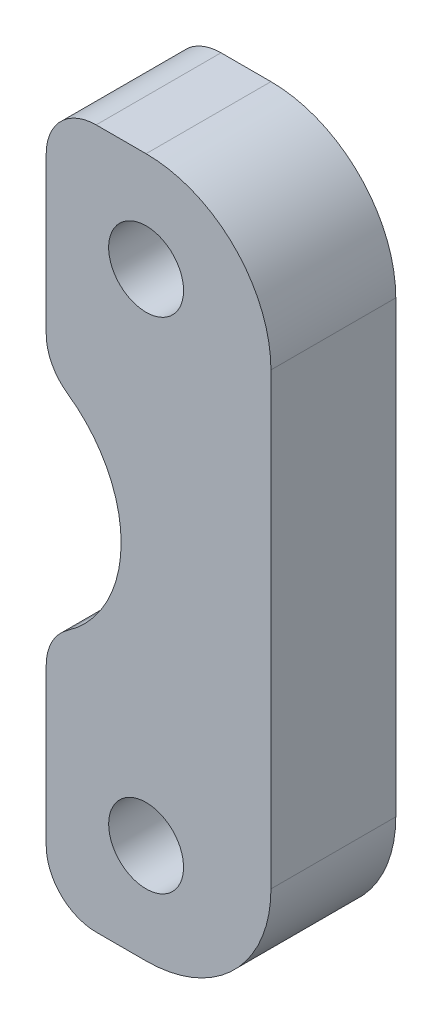
from build123d import *

# Parameters (mm, degrees)
ESQUISSE1_R        = 1.5
BOSS_EXTRU_1_DEPTH = 5
CONG_1_R           = 5
CONG_2_R           = 2


with BuildPart() as part:
    # Esquisse1 → Boss.-Extru.1 (new body)
    with BuildSketch(Plane.XY):
        with BuildLine():
            Line((2, 14), (2, 4.582575695))
            ThreePointArc((2, 4.582575695), (5, 0), (2, -4.582575695))
            Line((2, -4.582575695), (2, -14))
            Line((2, -14), (11, -14))
            Line((11, -14), (11, 14))
            Line((11, 14), (2, 14))
        make_face()
        with Locations((6, 10)):
            Circle(ESQUISSE1_R, mode=Mode.SUBTRACT)
        with Locations((6, -10)):
            Circle(ESQUISSE1_R, mode=Mode.SUBTRACT)
    extrude(amount=BOSS_EXTRU_1_DEPTH)

    # Congé1
    cong_1_edges = [part.edges().sort_by_distance(p)[0] for p in [
        (11, -14, 2.5),
        (11, 14, 2.5),
    ]]
    fillet(cong_1_edges, radius=CONG_1_R)

    # Congé2
    cong_2_edges = [part.edges().sort_by_distance(p)[0] for p in [
        (2, -14, 2.5),
        (2, -4.582575695, 2.5),
        (2, 4.582575695, 2.5),
        (2, 14, 2.5),
    ]]
    fillet(cong_2_edges, radius=CONG_2_R)


solid = part.part
